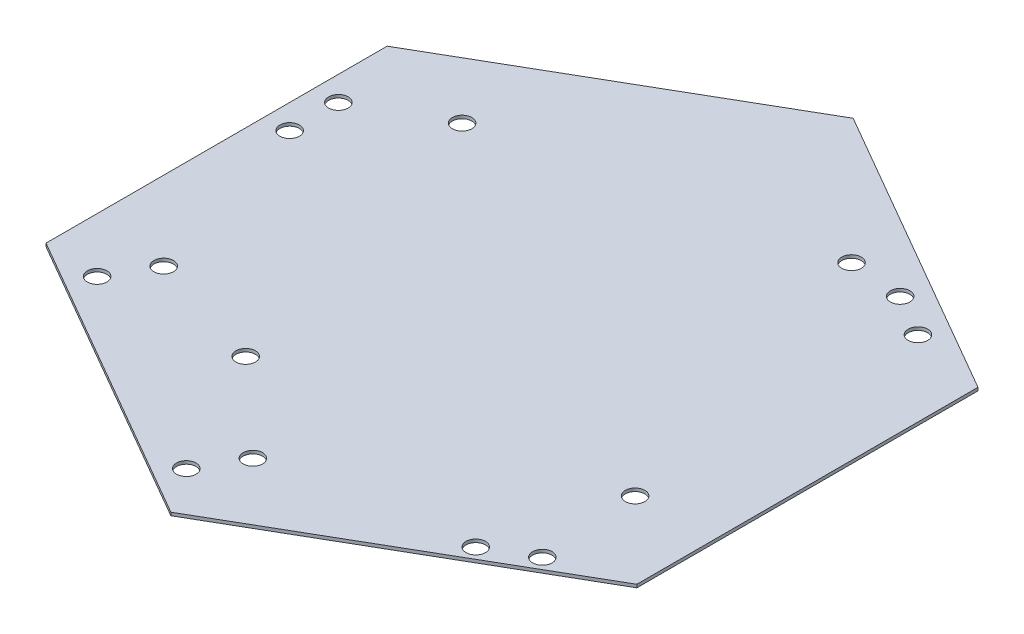
from build123d import *

# Parameters (mm, degrees)
SKETCH1_R           = 2.54
BOSS_EXTRUDE1_DEPTH = 0.8128
SKETCH2_R           = 2.54
CUT_EXTRUDE1_DEPTH  = 118.606454516
SKETCH3_R           = 2.54
CUT_EXTRUDE2_DEPTH  = 118.606454516


with BuildPart() as part:
    # Sketch1 → Boss-Extrude1 (new body)
    with BuildSketch(Plane(origin=(0, 0, 0), x_dir=(1, 0, 0), z_dir=(0, 1, 0))):
        Polygon((0, 88.9), (-76.989658396, 44.45), (-76.989658396, -44.45), (0, -88.9), (76.989658396, -44.45), (76.989658396, 44.45), align=None)
        with Locations((47.588351826, -57.025443212)):
            Circle(SKETCH1_R, mode=Mode.SUBTRACT)
        with Locations((58.586874454, -50.675443212)):
            Circle(SKETCH1_R, mode=Mode.SUBTRACT)
        with Locations((-70.639658396, 12.7)):
            Circle(SKETCH1_R, mode=Mode.SUBTRACT)
        with Locations((-70.639658396, 25.4)):
            Circle(SKETCH1_R, mode=Mode.SUBTRACT)
        with Locations((46.318351826, 54.825738686)):
            Circle(SKETCH1_R, mode=Mode.SUBTRACT)
        with Locations((57.316874454, 48.475738686)):
            Circle(SKETCH1_R, mode=Mode.SUBTRACT)
    extrude(amount=BOSS_EXTRUDE1_DEPTH)

    # Sketch2 → Cut-Extrude1 (cut, through all)
    with BuildSketch(Plane(origin=(0, 0.8128, 0), x_dir=(1, 0, 0), z_dir=(0, 1, 0))):
        with Locations((-49.850334746, 36.846687445)):
            Circle(SKETCH2_R)
        with Locations((-25.4, -43.994090512)):
            Circle(SKETCH2_R)
        with Locations((32.385, 56.092465403)):
            Circle(SKETCH2_R)
        with Locations((56.835334746, -24.748312555)):
            Circle(SKETCH2_R)
    extrude(amount=-CUT_EXTRUDE1_DEPTH, mode=Mode.SUBTRACT)

    # Sketch3 → Cut-Extrude2 (cut, through all)
    with BuildSketch(Plane(origin=(0, 0.8128, 0), x_dir=(1, 0, 0), z_dir=(0, 1, 0))):
        with Locations((-7.823522628, -77.050738686)):
            Circle(SKETCH3_R)
        with Locations((-62.816135768, -45.300738686)):
            Circle(SKETCH3_R)
        with Locations((-56.466135768, -34.302216058)):
            Circle(SKETCH3_R)
        with Locations((-1.473522628, -66.052216058)):
            Circle(SKETCH3_R)
    extrude(amount=-CUT_EXTRUDE2_DEPTH, mode=Mode.SUBTRACT)


solid = part.part
